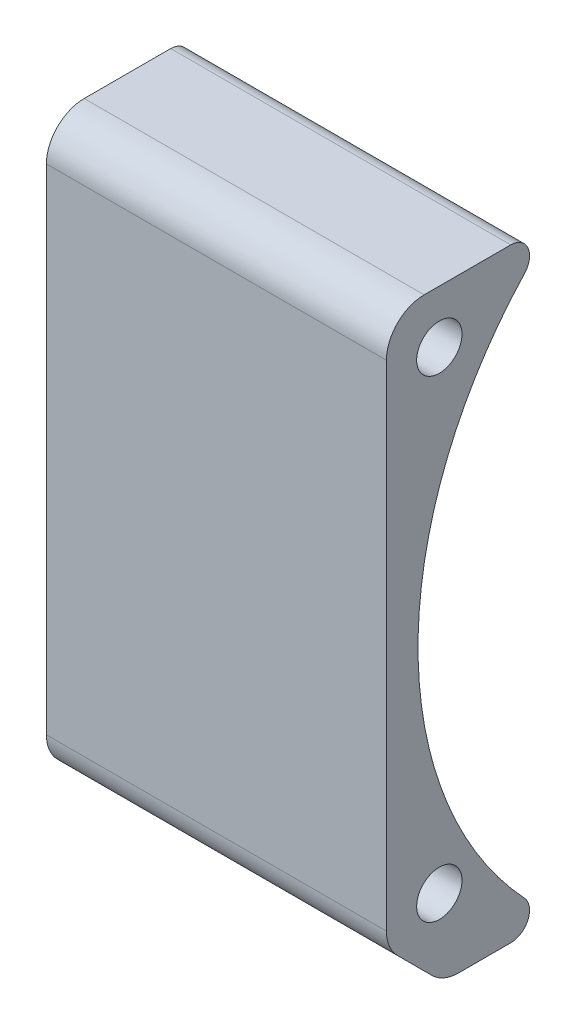
from build123d import *

# Parameters (mm, degrees)
BOSS_EXTRUDE1_DEPTH   = 28.575
CHAMFER1_SIZE         = 4.7625
FILLET1_R             = 3.175
FILLET2_R             = 1.5875
F_8_CLEARANCE_HOLE1_D = 3.81


with BuildPart() as part:
    # Sketch1 → Boss-Extrude1 (new body)
    with BuildSketch(Plane(origin=(0, 0, 0), x_dir=(0, 0, -1), z_dir=(1, 0, 0))):
        with BuildLine():
            Line((0, 0), (0, 50.8))
            Line((0, 50.8), (14.399754562, 50.8))
            ThreePointArc((14.399754562, 50.8), (2.654588994, 25.4), (14.399754562, 0))
            Line((14.399754562, 0), (0, 0))
        make_face()
    extrude(amount=BOSS_EXTRUDE1_DEPTH)

    # Chamfer1
    chamfer1_edges = [part.edges().sort_by_distance(p)[0] for p in [
        (14.2875, 0, 0),
    ]]
    chamfer(chamfer1_edges, length=CHAMFER1_SIZE)

    # Fillet1
    fillet1_edges = [part.edges().sort_by_distance(p)[0] for p in [
        (14.2875, 4.7625, 0),
        (14.2875, 0, -4.7625),
        (14.2875, 50.8, 0),
    ]]
    fillet(fillet1_edges, radius=FILLET1_R)

    # Fillet2
    fillet2_edges = [part.edges().sort_by_distance(p)[0] for p in [
        (14.2875, 50.8, -14.399754562),
        (14.2875, 0, -14.399754562),
    ]]
    fillet(fillet2_edges, radius=FILLET2_R)

    # #8 Clearance Hole1 (through all)
    with Locations(Plane(origin=(28.575, 0, 0), x_dir=(0, 0, -1), z_dir=(1, 0, 0))):
        with Locations((4.445, 46.355), (4.445, 6.603679285)):
            Hole(F_8_CLEARANCE_HOLE1_D / 2)


solid = part.part
